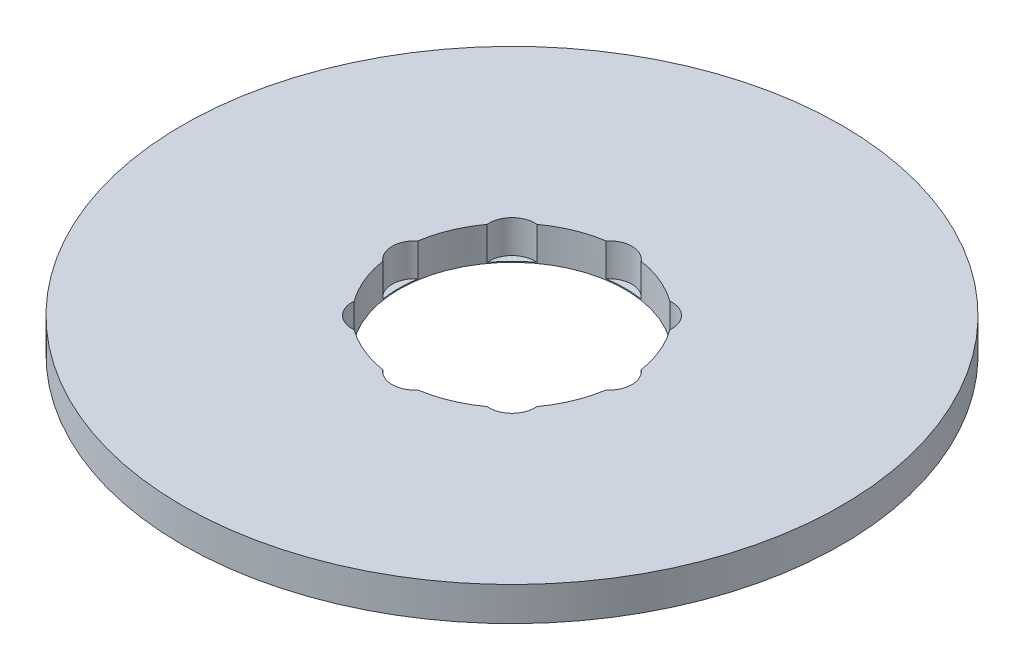
from build123d import *

# Parameters (mm, degrees)
SKETCH1_R           = 87.5
BOSS_EXTRUDE1_DEPTH = 9
SKETCH2_R           = 30
CUT_EXTRUDE1_DEPTH  = 125.07054445
SKETCH3_R           = 6.083163362
CUT_EXTRUDE2_DEPTH  = 8.733806307
CIRPATTERN1_COUNT   = 8


with BuildPart() as part:
    # Sketch1 → Boss-Extrude1 (new body)
    with BuildSketch(Plane(origin=(0, 0, 0), x_dir=(1, 0, 0), z_dir=(0, 1, 0))):
        Circle(SKETCH1_R)
    extrude(amount=BOSS_EXTRUDE1_DEPTH)

    # Sketch2 → Cut-Extrude1 (cut, through all)
    with BuildSketch(Plane(origin=(0, 0, 0), x_dir=(1, 0, 0), z_dir=(0, 1, 0))):
        Circle(SKETCH2_R)
    extrude(amount=CUT_EXTRUDE1_DEPTH, mode=Mode.SUBTRACT)

    # Sketch3 → Cut-Extrude2 (cut)
    with BuildSketch(Plane(origin=(0, 9, 0), x_dir=(1, 0, 0), z_dir=(0, 1, 0))):
        with Locations((-25.73899343, 0)):
            Circle(SKETCH3_R)
    cut_extrude2 = extrude(amount=-CUT_EXTRUDE2_DEPTH, mode=Mode.SUBTRACT)

    # CirPattern1: Cut-Extrude2 ×8 about axis
    cirpattern1_axis = Axis((0, 0, 0), (0, 1, 0))
    for i in range(1, CIRPATTERN1_COUNT):
        add(cut_extrude2.rotate(cirpattern1_axis, i * 360 / CIRPATTERN1_COUNT), mode=Mode.SUBTRACT)


solid = part.part
